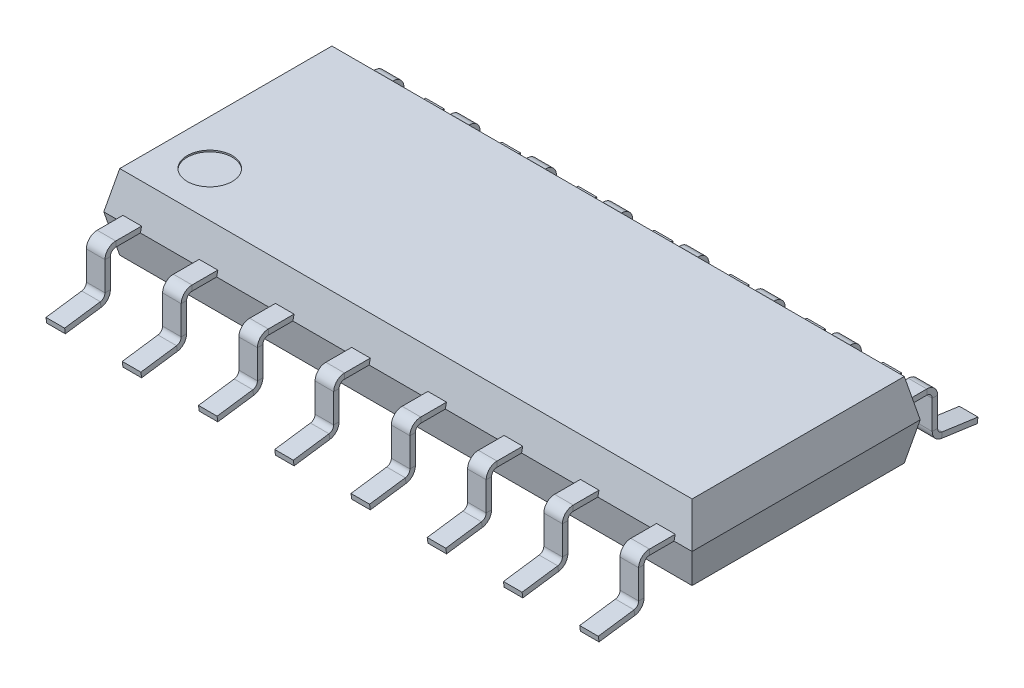
from build123d import *

# Parameters (mm, degrees)
SKETCH1_W                     = 9.8
SKETCH1_H                     = 3.8
BOSS_EXTRUDE1_DEPTH           = 0.625
BOSS_EXTRUDE1_TAPER           = 12
BOSS_EXTRUDE1_OTHER_WAY_DEPTH = 0.625
BOSS_EXTRUDE1_OTHER_WAY_TAPER = 12
BASE_FLANGE1_DEPTH            = 0.155
BASE_FLANGE1_DEPTH_BACK       = 0.155
LPATTERN1_COUNT               = 5
LPATTERN1_PITCH               = 1.27
LPATTERN1_2_COUNT             = 4
LPATTERN1_2_PITCH             = 1.27
BASE_FLANGE2_DEPTH            = 0.155
BASE_FLANGE2_DEPTH_BACK       = 0.155
LPATTERN2_COUNT               = 4
LPATTERN2_PITCH               = 1.27
LPATTERN2_2_COUNT             = 5
LPATTERN2_2_PITCH             = 1.27
SKETCH87_R                    = 0.375
CUT_EXTRUDE1_DEPTH            = 0.025


# Sheet-metal steps are written as plain solids
with BuildPart() as part:
    # Sketch1 → Boss-Extrude1 (new body)
    with BuildSketch(Plane(origin=(0, 0, 0), x_dir=(1, 0, 0), z_dir=(0, 1, 0))):
        Rectangle(SKETCH1_W, SKETCH1_H)
    extrude(amount=BOSS_EXTRUDE1_DEPTH, taper=BOSS_EXTRUDE1_TAPER)

    # Sketch1 → Boss-Extrude1 other way (add)
    with BuildSketch(Plane(origin=(0, 0, 0), x_dir=(1, 0, 0), z_dir=(0, 1, 0))):
        Rectangle(SKETCH1_W, SKETCH1_H)
    extrude(amount=-BOSS_EXTRUDE1_OTHER_WAY_DEPTH, taper=BOSS_EXTRUDE1_OTHER_WAY_TAPER)

    # Sketch87 → Cut-Extrude1 (cut)
    with BuildSketch(Plane(origin=(0, 0.625, 0), x_dir=(1, 0, 0), z_dir=(0, 1, 0))):
        with Locations(Location((-4.017152149, -1.017152149, 0), (0, 0, 270))):
            Circle(SKETCH87_R)
    extrude(amount=-CUT_EXTRUDE1_DEPTH, mode=Mode.SUBTRACT)


with BuildPart() as body_2:
    # Sketch2 → Base-Flange1 (new, two sides: drawn at the far end of the back side and taken through both)
    with BuildSketch(Plane(origin=(-0.635, 0, 0), x_dir=(0, 0, -1), z_dir=(1, 0, 0)).offset(-BASE_FLANGE1_DEPTH_BACK)):
        with BuildLine():
            Line((-1.8, 0), (-1.9, 0))
            Line((-1.9, 0), (-2.31, 0))
            ThreePointArc((-2.31, 0), (-2.37363961, -0.02636039), (-2.4, -0.09))
            Line((-2.4, -0.09), (-2.4, -0.568528387))
            ThreePointArc((-2.4, -0.568528387), (-2.444152276, -0.686619012), (-2.554948842, -0.74677664))
            Line((-2.554948842, -0.74677664), (-3.15, -0.830405626))
            Line((-3.15, -0.830405626), (-3.162525579, -0.7412815))
            Line((-3.162525579, -0.7412815), (-2.567474421, -0.657652513))
            ThreePointArc((-2.567474421, -0.657652513), (-2.512076138, -0.6275737), (-2.49, -0.568528387))
            Line((-2.49, -0.568528387), (-2.49, -0.09))
            ThreePointArc((-2.49, -0.09), (-2.437279221, 0.037279221), (-2.31, 0.09))
            Line((-2.31, 0.09), (-1.9, 0.09))
            Line((-1.9, 0.09), (-1.8, 0.09))
            Line((-1.8, 0.09), (-1.8, 0))
        make_face()
    extrude(amount=BASE_FLANGE1_DEPTH + BASE_FLANGE1_DEPTH_BACK)


with BuildPart() as lpattern1_1:
    # LPattern1: pattern copy
    add(body_2.part.moved(Location(Vector(1, 0, 0) * (1 * LPATTERN1_PITCH))))


with BuildPart() as lpattern1_2:
    # LPattern1: pattern copy
    add(body_2.part.moved(Location(Vector(1, 0, 0) * (2 * LPATTERN1_PITCH))))


with BuildPart() as lpattern1_3:
    # LPattern1: pattern copy
    add(body_2.part.moved(Location(Vector(1, 0, 0) * (3 * LPATTERN1_PITCH))))


with BuildPart() as lpattern1_4:
    # LPattern1: pattern copy
    add(body_2.part.moved(Location(Vector(1, 0, 0) * (4 * LPATTERN1_PITCH))))


with BuildPart() as lpattern1_2_1:
    # LPattern1 2: pattern copy
    add(body_2.part.moved(Location(Vector(-1, 0, 0) * (1 * LPATTERN1_2_PITCH))))


with BuildPart() as lpattern1_2_2:
    # LPattern1 2: pattern copy
    add(body_2.part.moved(Location(Vector(-1, 0, 0) * (2 * LPATTERN1_2_PITCH))))


with BuildPart() as lpattern1_2_3:
    # LPattern1 2: pattern copy
    add(body_2.part.moved(Location(Vector(-1, 0, 0) * (3 * LPATTERN1_2_PITCH))))


with BuildPart() as body_10:
    # Sketch58 → Base-Flange2 (new, two sides: drawn at the far end of the back side and taken through both)
    with BuildSketch(Plane(origin=(-0.635, 0, 0), x_dir=(0, 0, -1), z_dir=(1, 0, 0)).offset(-BASE_FLANGE2_DEPTH_BACK)):
        with BuildLine():
            Line((1.8, 0), (1.9, 0))
            Line((1.9, 0), (2.31, 0))
            ThreePointArc((2.31, 0), (2.37363961, -0.02636039), (2.4, -0.09))
            Line((2.4, -0.09), (2.4, -0.568528387))
            ThreePointArc((2.4, -0.568528387), (2.444152276, -0.686619012), (2.554948842, -0.74677664))
            Line((2.554948842, -0.74677664), (3.15, -0.830405626))
            Line((3.15, -0.830405626), (3.162525579, -0.7412815))
            Line((3.162525579, -0.7412815), (2.567474421, -0.657652513))
            ThreePointArc((2.567474421, -0.657652513), (2.512076138, -0.6275737), (2.49, -0.568528387))
            Line((2.49, -0.568528387), (2.49, -0.09))
            ThreePointArc((2.49, -0.09), (2.437279221, 0.037279221), (2.31, 0.09))
            Line((2.31, 0.09), (1.9, 0.09))
            Line((1.9, 0.09), (1.8, 0.09))
            Line((1.8, 0.09), (1.8, 0))
        make_face()
    extrude(amount=BASE_FLANGE2_DEPTH + BASE_FLANGE2_DEPTH_BACK)


with BuildPart() as lpattern2_1:
    # LPattern2: pattern copy
    add(body_10.part.moved(Location(Vector(-1, 0, 0) * (1 * LPATTERN2_PITCH))))


with BuildPart() as lpattern2_2:
    # LPattern2: pattern copy
    add(body_10.part.moved(Location(Vector(-1, 0, 0) * (2 * LPATTERN2_PITCH))))


with BuildPart() as lpattern2_3:
    # LPattern2: pattern copy
    add(body_10.part.moved(Location(Vector(-1, 0, 0) * (3 * LPATTERN2_PITCH))))


with BuildPart() as lpattern2_2_1:
    # LPattern2 2: pattern copy
    add(body_10.part.moved(Location(Vector(1, 0, 0) * (1 * LPATTERN2_2_PITCH))))


with BuildPart() as lpattern2_2_2:
    # LPattern2 2: pattern copy
    add(body_10.part.moved(Location(Vector(1, 0, 0) * (2 * LPATTERN2_2_PITCH))))


with BuildPart() as lpattern2_2_3:
    # LPattern2 2: pattern copy
    add(body_10.part.moved(Location(Vector(1, 0, 0) * (3 * LPATTERN2_2_PITCH))))


with BuildPart() as lpattern2_2_4:
    # LPattern2 2: pattern copy
    add(body_10.part.moved(Location(Vector(1, 0, 0) * (4 * LPATTERN2_2_PITCH))))


solid = Compound([part.part, body_2.part, lpattern1_1.part, lpattern1_2.part, lpattern1_3.part, lpattern1_4.part, lpattern1_2_1.part, lpattern1_2_2.part, lpattern1_2_3.part, body_10.part, lpattern2_1.part, lpattern2_2.part, lpattern2_3.part, lpattern2_2_1.part, lpattern2_2_2.part, lpattern2_2_3.part, lpattern2_2_4.part])
